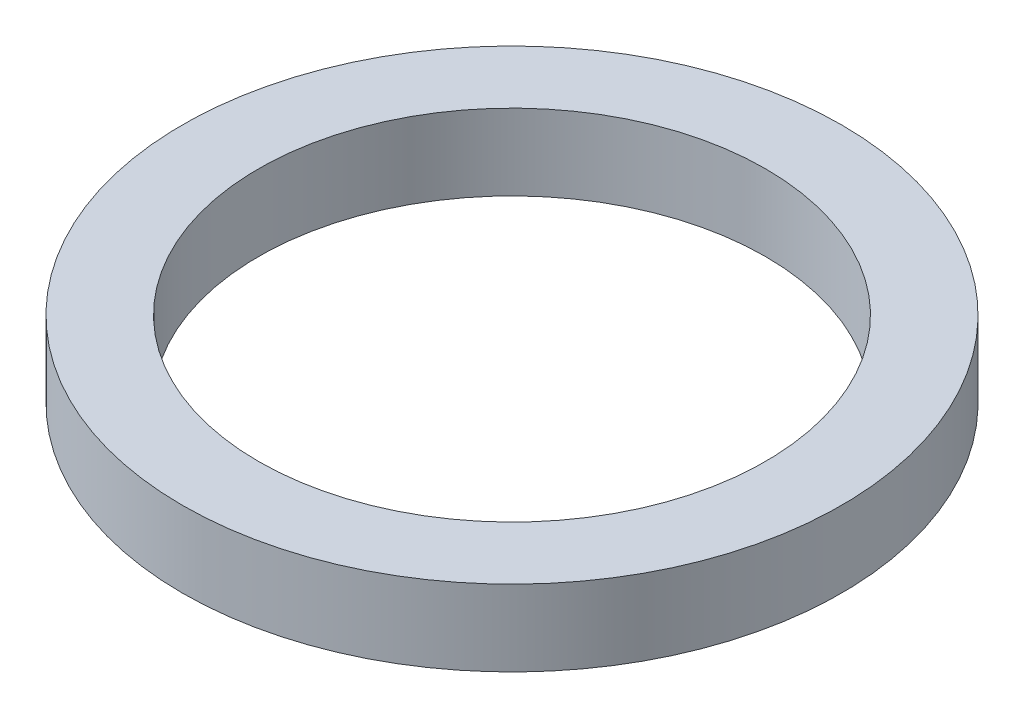
from build123d import *

# Parameters (mm, degrees)
SKETCH1_R           = 65
BOSS_EXTRUDE1_DEPTH = 15
SKETCH2_R           = 50
CUT_EXTRUDE1_DEPTH  = 94.139680051


with BuildPart() as part:
    # Sketch1 → Boss-Extrude1 (new body)
    with BuildSketch(Plane(origin=(0, 0, 0), x_dir=(1, 0, 0), z_dir=(0, 1, 0))):
        Circle(SKETCH1_R)
    extrude(amount=BOSS_EXTRUDE1_DEPTH)

    # Sketch2 → Cut-Extrude1 (cut, through all)
    with BuildSketch(Plane(origin=(0, 0, 0), x_dir=(1, 0, 0), z_dir=(0, 1, 0))):
        Circle(SKETCH2_R)
    extrude(amount=CUT_EXTRUDE1_DEPTH, mode=Mode.SUBTRACT)


solid = part.part
